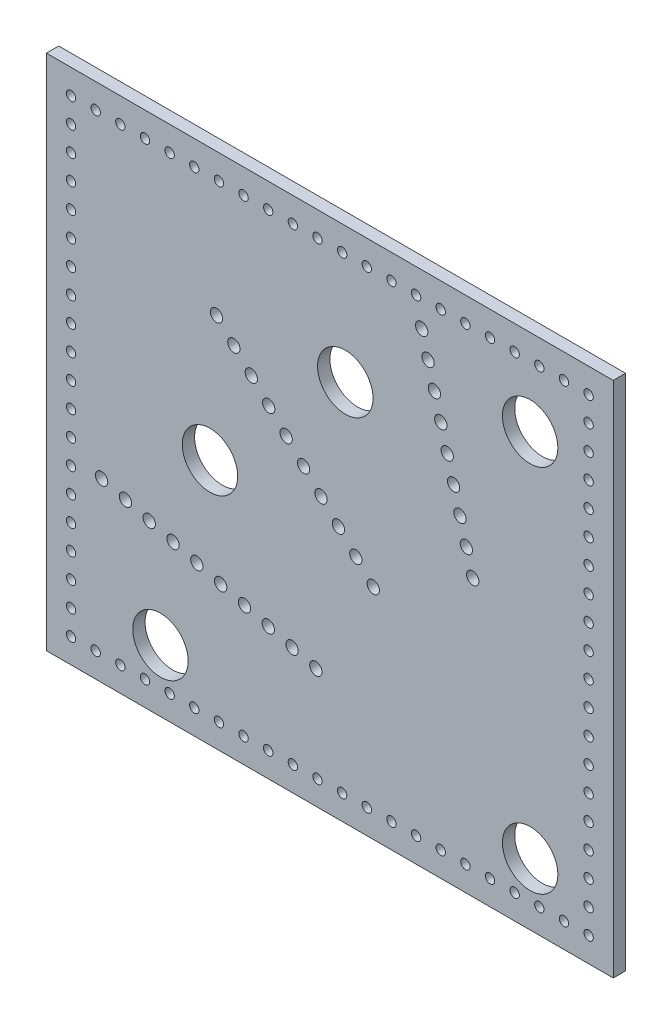
from build123d import *

# Parameters (mm, degrees)
SKETCH1_W                      = 292.1
SKETCH1_H                      = 266.7
SKETCH1_R                      = 14.2875
I_CAN_CHANGE_THESE_NAMES_DEPTH = 6.35
SKETCH2_R                      = 2.413
NO_WAY_BRO_DEPTH               = 6.35
SKETCH5_R                      = 3.175
CUT_EXTRUDE3_DEPTH             = 6.35


with BuildPart() as part:
    # Sketch1 → I CAN CHANGE THESE NAMES?! (new body)
    with BuildSketch(Plane.XY):
        with Locations((-103.2077505, 101.473326265)):
            Rectangle(SKETCH1_W, SKETCH1_H)
        Circle(SKETCH1_R, mode=Mode.SUBTRACT)
        with Locations((-190.5, 0)):
            Circle(SKETCH1_R, mode=Mode.SUBTRACT)
        with Locations((-164.977839421, 95.25)):
            Circle(SKETCH1_R, mode=Mode.SUBTRACT)
        with Locations((-95.25, 164.977839421)):
            Circle(SKETCH1_R, mode=Mode.SUBTRACT)
        with Locations((0, 190.5)):
            Circle(SKETCH1_R, mode=Mode.SUBTRACT)
    extrude(amount=I_CAN_CHANGE_THESE_NAMES_DEPTH)

    # Sketch2 → NO WAY BRO (cut)
    with BuildSketch(Plane.XY.offset(6.35)):
        with Locations((30.1422495, 222.123326265)):
            Circle(SKETCH2_R)
        with Locations((30.1422495, 209.423326265)):
            Circle(SKETCH2_R)
        with Locations((30.1422495, 196.723326265)):
            Circle(SKETCH2_R)
        with Locations((30.1422495, 184.023326265)):
            Circle(SKETCH2_R)
        with Locations((30.1422495, 171.323326265)):
            Circle(SKETCH2_R)
        with Locations((30.1422495, 158.623326265)):
            Circle(SKETCH2_R)
        with Locations((30.1422495, 145.923326265)):
            Circle(SKETCH2_R)
        with Locations((30.1422495, 133.223326265)):
            Circle(SKETCH2_R)
        with Locations((30.1422495, 120.523326265)):
            Circle(SKETCH2_R)
        with Locations((30.1422495, 107.823326265)):
            Circle(SKETCH2_R)
        with Locations((30.1422495, 95.123326265)):
            Circle(SKETCH2_R)
        with Locations((30.1422495, 82.423326265)):
            Circle(SKETCH2_R)
        with Locations((30.1422495, 69.723326265)):
            Circle(SKETCH2_R)
        with Locations((30.1422495, 57.023326265)):
            Circle(SKETCH2_R)
        with Locations((30.1422495, 44.323326265)):
            Circle(SKETCH2_R)
        with Locations((30.1422495, 31.623326265)):
            Circle(SKETCH2_R)
        with Locations((30.1422495, 18.923326265)):
            Circle(SKETCH2_R)
        with Locations((30.1422495, 6.223326265)):
            Circle(SKETCH2_R)
        with Locations((30.1422495, -6.476673735)):
            Circle(SKETCH2_R)
        with Locations((30.1422495, -19.176673735)):
            Circle(SKETCH2_R)
        with Locations((17.4422495, 222.123326265)):
            Circle(SKETCH2_R)
        with Locations((4.7422495, 222.123326265)):
            Circle(SKETCH2_R)
        with Locations((-7.9577505, 222.123326265)):
            Circle(SKETCH2_R)
        with Locations((-20.6577505, 222.123326265)):
            Circle(SKETCH2_R)
        with Locations((-33.3577505, 222.123326265)):
            Circle(SKETCH2_R)
        with Locations((-46.0577505, 222.123326265)):
            Circle(SKETCH2_R)
        with Locations((-58.7577505, 222.123326265)):
            Circle(SKETCH2_R)
        with Locations((-71.4577505, 222.123326265)):
            Circle(SKETCH2_R)
        with Locations((-84.1577505, 222.123326265)):
            Circle(SKETCH2_R)
        with Locations((-96.8577505, 222.123326265)):
            Circle(SKETCH2_R)
        with Locations((-109.5577505, 222.123326265)):
            Circle(SKETCH2_R)
        with Locations((-122.2577505, 222.123326265)):
            Circle(SKETCH2_R)
        with Locations((-134.9577505, 222.123326265)):
            Circle(SKETCH2_R)
        with Locations((-147.6577505, 222.123326265)):
            Circle(SKETCH2_R)
        with Locations((-160.3577505, 222.123326265)):
            Circle(SKETCH2_R)
        with Locations((-173.0577505, 222.123326265)):
            Circle(SKETCH2_R)
        with Locations((-185.7577505, 222.123326265)):
            Circle(SKETCH2_R)
        with Locations((-198.4577505, 222.123326265)):
            Circle(SKETCH2_R)
        with Locations((-211.1577505, 222.123326265)):
            Circle(SKETCH2_R)
        with Locations((-223.8577505, 222.123326265)):
            Circle(SKETCH2_R)
        with Locations((-236.5577505, 222.123326265)):
            Circle(SKETCH2_R)
        with Locations((-236.5577505, 209.423326265)):
            Circle(SKETCH2_R)
        with Locations((-236.5577505, 196.723326265)):
            Circle(SKETCH2_R)
        with Locations((-236.5577505, 184.023326265)):
            Circle(SKETCH2_R)
        with Locations((-236.5577505, 171.323326265)):
            Circle(SKETCH2_R)
        with Locations((-236.5577505, 158.623326265)):
            Circle(SKETCH2_R)
        with Locations((-236.5577505, 145.923326265)):
            Circle(SKETCH2_R)
        with Locations((-236.5577505, 133.223326265)):
            Circle(SKETCH2_R)
        with Locations((-236.5577505, 120.523326265)):
            Circle(SKETCH2_R)
        with Locations((-236.5577505, 107.823326265)):
            Circle(SKETCH2_R)
        with Locations((-236.5577505, 95.123326265)):
            Circle(SKETCH2_R)
        with Locations((-236.5577505, 82.423326265)):
            Circle(SKETCH2_R)
        with Locations((-236.5577505, 69.723326265)):
            Circle(SKETCH2_R)
        with Locations((-236.5577505, 57.023326265)):
            Circle(SKETCH2_R)
        with Locations((-236.5577505, 44.323326265)):
            Circle(SKETCH2_R)
        with Locations((-236.5577505, 31.623326265)):
            Circle(SKETCH2_R)
        with Locations((-236.5577505, 18.923326265)):
            Circle(SKETCH2_R)
        with Locations((-236.5577505, 6.223326265)):
            Circle(SKETCH2_R)
        with Locations((-236.5577505, -6.476673735)):
            Circle(SKETCH2_R)
        with Locations((-236.5577505, -19.176673735)):
            Circle(SKETCH2_R)
        with Locations((-223.8577505, -19.176673735)):
            Circle(SKETCH2_R)
        with Locations((-211.1577505, -19.176673735)):
            Circle(SKETCH2_R)
        with Locations((-198.4577505, -19.176673735)):
            Circle(SKETCH2_R)
        with Locations((-185.7577505, -19.176673735)):
            Circle(SKETCH2_R)
        with Locations((-173.0577505, -19.176673735)):
            Circle(SKETCH2_R)
        with Locations((-160.3577505, -19.176673735)):
            Circle(SKETCH2_R)
        with Locations((-147.6577505, -19.176673735)):
            Circle(SKETCH2_R)
        with Locations((-134.9577505, -19.176673735)):
            Circle(SKETCH2_R)
        with Locations((-122.2577505, -19.176673735)):
            Circle(SKETCH2_R)
        with Locations((-109.5577505, -19.176673735)):
            Circle(SKETCH2_R)
        with Locations((-96.8577505, -19.176673735)):
            Circle(SKETCH2_R)
        with Locations((-84.1577505, -19.176673735)):
            Circle(SKETCH2_R)
        with Locations((-71.4577505, -19.176673735)):
            Circle(SKETCH2_R)
        with Locations((-58.7577505, -19.176673735)):
            Circle(SKETCH2_R)
        with Locations((-46.0577505, -19.176673735)):
            Circle(SKETCH2_R)
        with Locations((-33.3577505, -19.176673735)):
            Circle(SKETCH2_R)
        with Locations((-20.6577505, -19.176673735)):
            Circle(SKETCH2_R)
        with Locations((-7.9577505, -19.176673735)):
            Circle(SKETCH2_R)
        with Locations((4.7422495, -19.176673735)):
            Circle(SKETCH2_R)
        with Locations((17.4422495, -19.176673735)):
            Circle(SKETCH2_R)
    extrude(amount=-NO_WAY_BRO_DEPTH, mode=Mode.SUBTRACT)

    # Sketch5 → Cut-Extrude3 (cut)
    with BuildSketch(Plane.XY.offset(6.35)):
        with Locations((-161.644610179, 161.644610179)):
            Circle(SKETCH5_R)
        with Locations((-55.879031838, 208.543385896)):
            Circle(SKETCH5_R)
        with Locations((-220.81064389, 59.16603371)):
            Circle(SKETCH5_R)
        with Locations((-208.543385896, 55.879031838)):
            Circle(SKETCH5_R)
        with Locations((-196.276127902, 52.592029965)):
            Circle(SKETCH5_R)
        with Locations((-184.008869908, 49.305028092)):
            Circle(SKETCH5_R)
        with Locations((-171.741611914, 46.018026219)):
            Circle(SKETCH5_R)
        with Locations((-159.47435392, 42.731024346)):
            Circle(SKETCH5_R)
        with Locations((-147.207095926, 39.444022474)):
            Circle(SKETCH5_R)
        with Locations((-134.939837933, 36.157020601)):
            Circle(SKETCH5_R)
        with Locations((-122.672579939, 32.870018728)):
            Circle(SKETCH5_R)
        with Locations((-110.405321945, 29.583016855)):
            Circle(SKETCH5_R)
        with Locations((-152.664354058, 152.664354058)):
            Circle(SKETCH5_R)
        with Locations((-143.684097937, 143.684097937)):
            Circle(SKETCH5_R)
        with Locations((-134.703841816, 134.703841816)):
            Circle(SKETCH5_R)
        with Locations((-125.723585695, 125.723585695)):
            Circle(SKETCH5_R)
        with Locations((-116.743329574, 116.743329574)):
            Circle(SKETCH5_R)
        with Locations((-107.763073453, 107.763073453)):
            Circle(SKETCH5_R)
        with Locations((-98.782817332, 98.782817332)):
            Circle(SKETCH5_R)
        with Locations((-89.802561211, 89.802561211)):
            Circle(SKETCH5_R)
        with Locations((-80.82230509, 80.82230509)):
            Circle(SKETCH5_R)
        with Locations((-52.592029965, 196.276127902)):
            Circle(SKETCH5_R)
        with Locations((-49.305028092, 184.008869908)):
            Circle(SKETCH5_R)
        with Locations((-46.018026219, 171.741611914)):
            Circle(SKETCH5_R)
        with Locations((-42.731024346, 159.47435392)):
            Circle(SKETCH5_R)
        with Locations((-39.444022474, 147.207095926)):
            Circle(SKETCH5_R)
        with Locations((-36.157020601, 134.939837933)):
            Circle(SKETCH5_R)
        with Locations((-32.870018728, 122.672579939)):
            Circle(SKETCH5_R)
        with Locations((-29.583016855, 110.405321945)):
            Circle(SKETCH5_R)
    extrude(amount=-CUT_EXTRUDE3_DEPTH, mode=Mode.SUBTRACT)


solid = part.part
